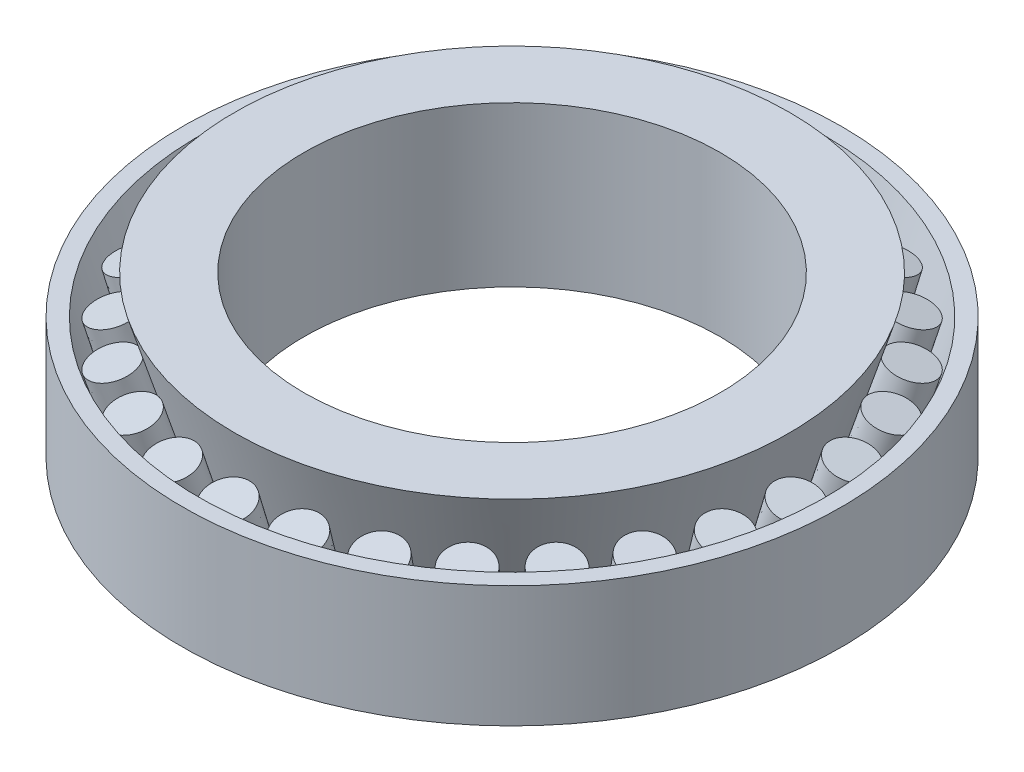
from build123d import *

# Parameters (mm, degrees)
R_P_TITION_CIRCULAIRE1_COUNT = 28


with BuildPart() as part:
    # Esquisse5 → Révolution1 (revolve)
    with BuildSketch(Plane.XY):
        Polygon((-30, 0), (-33, 0), (-40, 23), (-30, 23), align=None)
        Polygon((-47.5, 17.5), (-47.5, 0), (-40, 0), (-45.119286342, 17.5), align=None)
    revolve(axis=Axis((0, 0, 0), (0, 1, 0)))


with BuildPart() as body_2:
    # Esquisse6 → Révolution2 (revolve)
    with BuildSketch(Plane.XY):
        Polygon((-40.978164998, 15.005282288), (-37.850874733, 15.938588409), (-33.667492232, 2.193188761), (-36.869356415, 1.237626857), align=None)
    revolve(axis=Axis((-41.722686649, 17.5, 0), (0.28597549839444864, -0.9582369301576968, 0)))


with BuildPart() as r_p_tition_circulaire1_1:
    # Répétition circulaire1: pattern copy
    add(body_2.part.rotate(Axis((0, 23, 0), (0, -1, 0)), 1 * 360 / R_P_TITION_CIRCULAIRE1_COUNT))


with BuildPart() as r_p_tition_circulaire1_2:
    # Répétition circulaire1: pattern copy
    add(body_2.part.rotate(Axis((0, 23, 0), (0, -1, 0)), 2 * 360 / R_P_TITION_CIRCULAIRE1_COUNT))


with BuildPart() as r_p_tition_circulaire1_3:
    # Répétition circulaire1: pattern copy
    add(body_2.part.rotate(Axis((0, 23, 0), (0, -1, 0)), 3 * 360 / R_P_TITION_CIRCULAIRE1_COUNT))


with BuildPart() as r_p_tition_circulaire1_4:
    # Répétition circulaire1: pattern copy
    add(body_2.part.rotate(Axis((0, 23, 0), (0, -1, 0)), 4 * 360 / R_P_TITION_CIRCULAIRE1_COUNT))


with BuildPart() as r_p_tition_circulaire1_5:
    # Répétition circulaire1: pattern copy
    add(body_2.part.rotate(Axis((0, 23, 0), (0, -1, 0)), 5 * 360 / R_P_TITION_CIRCULAIRE1_COUNT))


with BuildPart() as r_p_tition_circulaire1_6:
    # Répétition circulaire1: pattern copy
    add(body_2.part.rotate(Axis((0, 23, 0), (0, -1, 0)), 6 * 360 / R_P_TITION_CIRCULAIRE1_COUNT))


with BuildPart() as r_p_tition_circulaire1_7:
    # Répétition circulaire1: pattern copy
    add(body_2.part.rotate(Axis((0, 23, 0), (0, -1, 0)), 7 * 360 / R_P_TITION_CIRCULAIRE1_COUNT))


with BuildPart() as r_p_tition_circulaire1_8:
    # Répétition circulaire1: pattern copy
    add(body_2.part.rotate(Axis((0, 23, 0), (0, -1, 0)), 8 * 360 / R_P_TITION_CIRCULAIRE1_COUNT))


with BuildPart() as r_p_tition_circulaire1_9:
    # Répétition circulaire1: pattern copy
    add(body_2.part.rotate(Axis((0, 23, 0), (0, -1, 0)), 9 * 360 / R_P_TITION_CIRCULAIRE1_COUNT))


with BuildPart() as r_p_tition_circulaire1_10:
    # Répétition circulaire1: pattern copy
    add(body_2.part.rotate(Axis((0, 23, 0), (0, -1, 0)), 10 * 360 / R_P_TITION_CIRCULAIRE1_COUNT))


with BuildPart() as r_p_tition_circulaire1_11:
    # Répétition circulaire1: pattern copy
    add(body_2.part.rotate(Axis((0, 23, 0), (0, -1, 0)), 11 * 360 / R_P_TITION_CIRCULAIRE1_COUNT))


with BuildPart() as r_p_tition_circulaire1_12:
    # Répétition circulaire1: pattern copy
    add(body_2.part.rotate(Axis((0, 23, 0), (0, -1, 0)), 12 * 360 / R_P_TITION_CIRCULAIRE1_COUNT))


with BuildPart() as r_p_tition_circulaire1_13:
    # Répétition circulaire1: pattern copy
    add(body_2.part.rotate(Axis((0, 23, 0), (0, -1, 0)), 13 * 360 / R_P_TITION_CIRCULAIRE1_COUNT))


with BuildPart() as r_p_tition_circulaire1_14:
    # Répétition circulaire1: pattern copy
    add(body_2.part.rotate(Axis((0, 23, 0), (0, -1, 0)), 14 * 360 / R_P_TITION_CIRCULAIRE1_COUNT))


with BuildPart() as r_p_tition_circulaire1_15:
    # Répétition circulaire1: pattern copy
    add(body_2.part.rotate(Axis((0, 23, 0), (0, -1, 0)), 15 * 360 / R_P_TITION_CIRCULAIRE1_COUNT))


with BuildPart() as r_p_tition_circulaire1_16:
    # Répétition circulaire1: pattern copy
    add(body_2.part.rotate(Axis((0, 23, 0), (0, -1, 0)), 16 * 360 / R_P_TITION_CIRCULAIRE1_COUNT))


with BuildPart() as r_p_tition_circulaire1_17:
    # Répétition circulaire1: pattern copy
    add(body_2.part.rotate(Axis((0, 23, 0), (0, -1, 0)), 17 * 360 / R_P_TITION_CIRCULAIRE1_COUNT))


with BuildPart() as r_p_tition_circulaire1_18:
    # Répétition circulaire1: pattern copy
    add(body_2.part.rotate(Axis((0, 23, 0), (0, -1, 0)), 18 * 360 / R_P_TITION_CIRCULAIRE1_COUNT))


with BuildPart() as r_p_tition_circulaire1_19:
    # Répétition circulaire1: pattern copy
    add(body_2.part.rotate(Axis((0, 23, 0), (0, -1, 0)), 19 * 360 / R_P_TITION_CIRCULAIRE1_COUNT))


with BuildPart() as r_p_tition_circulaire1_20:
    # Répétition circulaire1: pattern copy
    add(body_2.part.rotate(Axis((0, 23, 0), (0, -1, 0)), 20 * 360 / R_P_TITION_CIRCULAIRE1_COUNT))


with BuildPart() as r_p_tition_circulaire1_21:
    # Répétition circulaire1: pattern copy
    add(body_2.part.rotate(Axis((0, 23, 0), (0, -1, 0)), 21 * 360 / R_P_TITION_CIRCULAIRE1_COUNT))


with BuildPart() as r_p_tition_circulaire1_22:
    # Répétition circulaire1: pattern copy
    add(body_2.part.rotate(Axis((0, 23, 0), (0, -1, 0)), 22 * 360 / R_P_TITION_CIRCULAIRE1_COUNT))


with BuildPart() as r_p_tition_circulaire1_23:
    # Répétition circulaire1: pattern copy
    add(body_2.part.rotate(Axis((0, 23, 0), (0, -1, 0)), 23 * 360 / R_P_TITION_CIRCULAIRE1_COUNT))


with BuildPart() as r_p_tition_circulaire1_24:
    # Répétition circulaire1: pattern copy
    add(body_2.part.rotate(Axis((0, 23, 0), (0, -1, 0)), 24 * 360 / R_P_TITION_CIRCULAIRE1_COUNT))


with BuildPart() as r_p_tition_circulaire1_25:
    # Répétition circulaire1: pattern copy
    add(body_2.part.rotate(Axis((0, 23, 0), (0, -1, 0)), 25 * 360 / R_P_TITION_CIRCULAIRE1_COUNT))


with BuildPart() as r_p_tition_circulaire1_26:
    # Répétition circulaire1: pattern copy
    add(body_2.part.rotate(Axis((0, 23, 0), (0, -1, 0)), 26 * 360 / R_P_TITION_CIRCULAIRE1_COUNT))


with BuildPart() as r_p_tition_circulaire1_27:
    # Répétition circulaire1: pattern copy
    add(body_2.part.rotate(Axis((0, 23, 0), (0, -1, 0)), 27 * 360 / R_P_TITION_CIRCULAIRE1_COUNT))


solid = Compound([part.part, body_2.part, r_p_tition_circulaire1_1.part, r_p_tition_circulaire1_2.part, r_p_tition_circulaire1_3.part, r_p_tition_circulaire1_4.part, r_p_tition_circulaire1_5.part, r_p_tition_circulaire1_6.part, r_p_tition_circulaire1_7.part, r_p_tition_circulaire1_8.part, r_p_tition_circulaire1_9.part, r_p_tition_circulaire1_10.part, r_p_tition_circulaire1_11.part, r_p_tition_circulaire1_12.part, r_p_tition_circulaire1_13.part, r_p_tition_circulaire1_14.part, r_p_tition_circulaire1_15.part, r_p_tition_circulaire1_16.part, r_p_tition_circulaire1_17.part, r_p_tition_circulaire1_18.part, r_p_tition_circulaire1_19.part, r_p_tition_circulaire1_20.part, r_p_tition_circulaire1_21.part, r_p_tition_circulaire1_22.part, r_p_tition_circulaire1_23.part, r_p_tition_circulaire1_24.part, r_p_tition_circulaire1_25.part, r_p_tition_circulaire1_26.part, r_p_tition_circulaire1_27.part])
